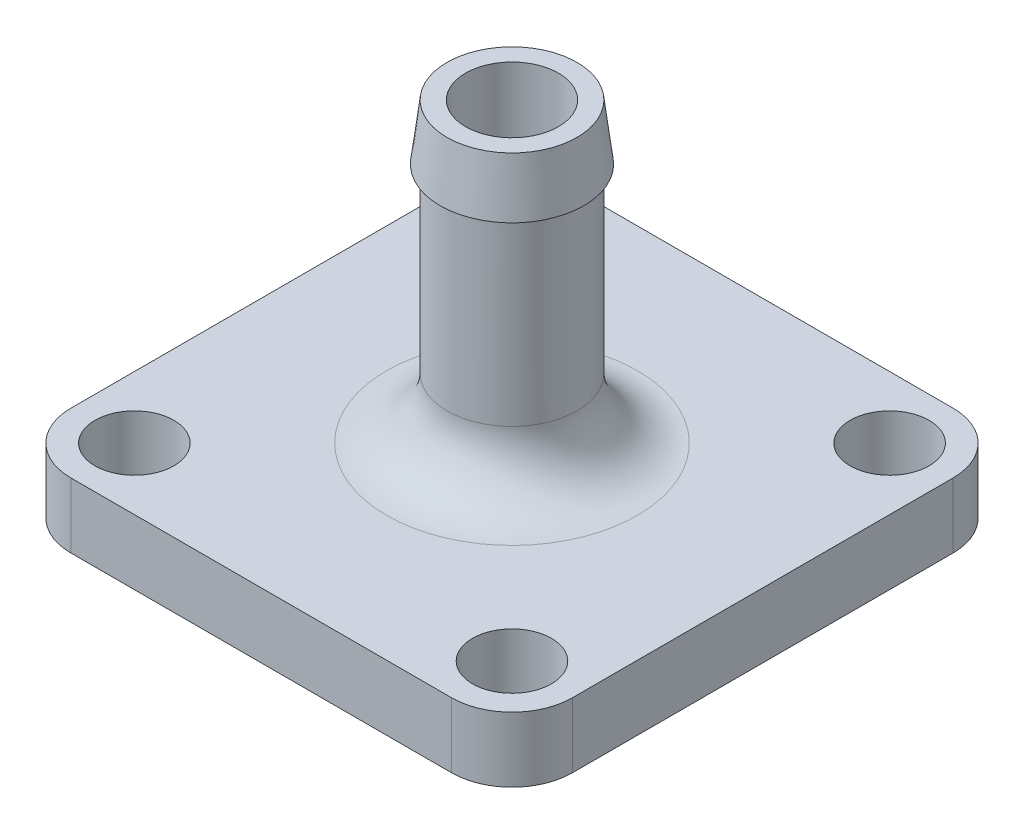
from build123d import *

# Parameters (mm, degrees)
SKETCH1_R           = 4.250000000000005
SKETCH1_R_2         = 4.250000000000013
SKETCH1_R_3         = 4.2500000000000036
BOSS_EXTRUDE1_DEPTH = 7
FILLET2_R           = 6.5
SKETCH4_R           = 7
BOSS_EXTRUDE3_DEPTH = 26
SKETCH5_R           = 7.75
BOSS_EXTRUDE4_DEPTH = 6
FILLET3_R           = 6.5
FILLET4_R           = 6.5
FILLET5_R           = 6.5


with BuildPart() as part:
    # Sketch1 → Boss-Extrude1 (new body)
    with BuildSketch(Plane(origin=(0, 0, 0), x_dir=(1, 0, 0), z_dir=(0, 1, 0))):
        Polygon((-27, 27), (27, 27), (27.000000000000007, -27), (-26.999999999999993, -27), align=None)
        with Locations(Location((-20.329319959113246, 20.329319959113246, 0), (0, 0, 270))):
            Circle(SKETCH1_R, mode=Mode.SUBTRACT)
        with Locations(Location((20.32931995911324, -20.329319959113246, 0), (0, 0, 90))):
            Circle(SKETCH1_R_2, mode=Mode.SUBTRACT)
        with Locations(Location((-20.329319959113224, -20.329319959113246, 0), (0, 0, 270))):
            Circle(SKETCH1_R_2, mode=Mode.SUBTRACT)
        with Locations(Location((20.329319959113246, 20.329319959113253, 0), (0, 0, 90))):
            Circle(SKETCH1_R_3, mode=Mode.SUBTRACT)
    extrude(amount=BOSS_EXTRUDE1_DEPTH)

    # Fillet2
    fillet2_edges = [part.edges().sort_by_distance(p)[0] for p in [
        (27.000000000000007, 3.5, 27),
        (-26.999999999999993, 3.5, 27),
        (-27, 3.5, -27),
        (27, 3.5, -27),
    ]]
    fillet(fillet2_edges, radius=FILLET2_R)

    # Sketch4 → Boss-Extrude3 (add)
    with BuildSketch(Plane(origin=(0, 7, 0), x_dir=(1, 0, 0), z_dir=(0, 1, 0))):
        with Locations(Location((0, 0, 0), (0, 0, 90))):
            Circle(SKETCH4_R)
    extrude(amount=BOSS_EXTRUDE3_DEPTH)

    # Sketch5 → Boss-Extrude4 (add)
    with BuildSketch(Plane(origin=(0, 33, 0), x_dir=(1, 0, 0), z_dir=(0, 1, 0))):
        with Locations(Location((0, 0, 0), (0, 0, 270))):
            Circle(SKETCH5_R)
    extrude(amount=BOSS_EXTRUDE4_DEPTH)

    # Sketch6 → Cut-Revolve1 (revolve, cut)
    with BuildSketch(Plane.XY, mode=Mode.PRIVATE) as cut_revolve1_sk:
        Polygon((6.8958692457127615, 39.84698008319777), (7.935722009021632, 31.389012156149754), (8.514556179291803, 31.389012156149754), (8.514556179291803, 39.84698008319777), align=None)
    revolve(cut_revolve1_sk.sketch.rotate(Axis((0, 39, 0), (0, -1, 0)), 90), axis=Axis((0, 39, 0), (0, -1, 0)), mode=Mode.SUBTRACT)

    # Fillet3
    fillet3_edges = [part.edges().sort_by_distance(p)[0] for p in [
        (-1.29e-15, 7, 7),
    ]]
    fillet(fillet3_edges, radius=FILLET3_R)

    # Sketch7 → Cut-Revolve2 (revolve, cut)
    with BuildSketch(Plane.XY, mode=Mode.PRIVATE) as cut_revolve2_sk:
        Polygon((4.999999999999997, 41.673662522697256), (5.000000000000003, 4.999999999999999), (14.500000000000009, 5), (14.50000000000001, 1.128e-14), (0, -2.109667236724723), (1.73e-15, 41.673662522697256), align=None)
    revolve(cut_revolve2_sk.sketch.rotate(Axis((1.73e-15, 41.673662522697256, 0), (-4e-17, -1, 0)), 180), axis=Axis((1.73e-15, 41.673662522697256, 0), (-4e-17, -1, 0)), mode=Mode.SUBTRACT)

    # Fillet4
    fillet4_edges = [part.edges().sort_by_distance(p)[0] for p in [
        (5.000000000000003, 5, -1.22e-15),
    ]]
    fillet(fillet4_edges, radius=FILLET4_R)

    # Fillet5
    # the kernel refuses this fillet: 6.5 mm, written as the material it adds along each edge
    with BuildSketch(Plane(origin=(2.8e-16, 5, 0), x_dir=(-1, 6e-17, 1.2e-16), z_dir=(1.2e-16, 0, 1))) as fillet5_piece_1:
        with BuildLine():
            CenterArc((8.084264649295068, 6.043235308880427), FILLET5_R, 285.23323327747323, 65.5309787307709)
            Line((14.500000000001535, 4.999999999999738), (15.141573535072181, 4.895676469111669))
            ThreePointArc((15.141573535072181, 4.895676469111669), (15.15000000000001, 2.499999999999869), (15.15000000000001, 4e-17))
            Line((15.15000000000001, 4e-17), (14.500000000000009, -0.6500000000000004))
            ThreePointArc((14.500000000000009, -0.6500000000000004), (11.499999999999995, -0.6500000000000006), (9.962919092182778, -0.8555441110038083))
            Line((9.962919092182778, -0.8555441110038083), (9.792132324647532, -0.22838234555978715))
        make_face()
    revolve(axis=Axis((2.8e-16, 5, 0), (-4e-17, -1, 0)))


solid = part.part
